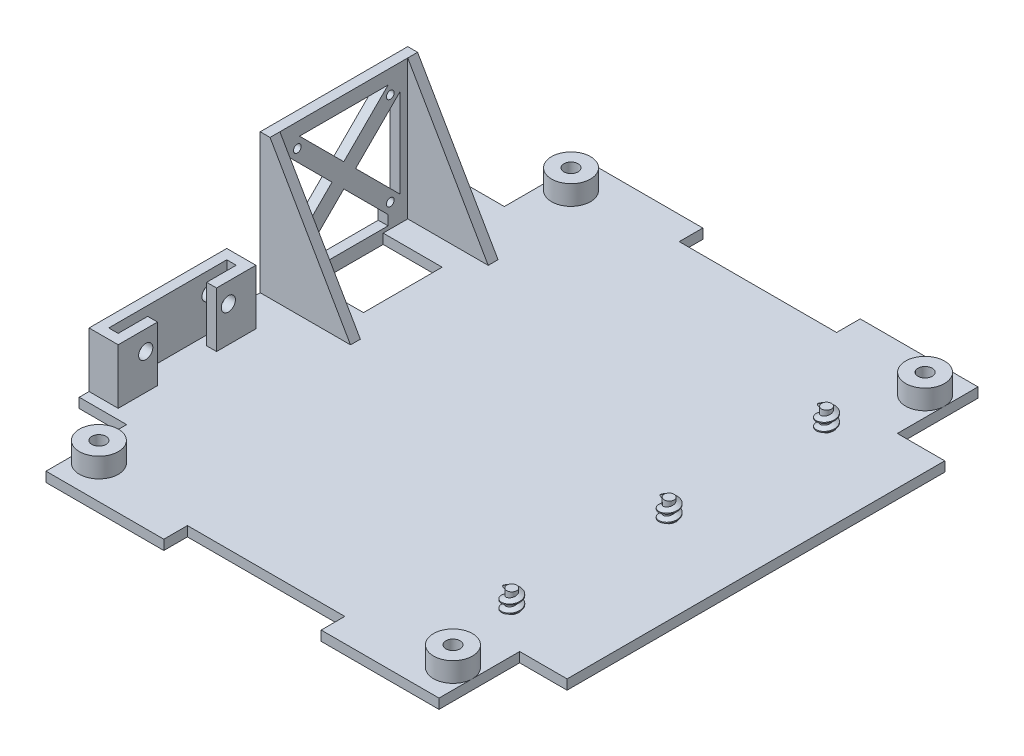
from build123d import *

# Parameters (mm, degrees)
SKETCH1_R           = 2.286
MAIN_BODY_DEPTH     = 3.175
SKETCH34_W          = 7.62
SKETCH34_H          = 50.8
BOSS_EXTRUDE3_DEPTH = 3.175
SKETCH3_R           = 1.5875
BOSS_EXTRUDE2_DEPTH = 6.35
THREAD1_PITCH       = 2.54
THREAD2_PITCH       = 2.54
THREAD3_PITCH       = 2.54
SKETCH35_R          = 6.28142
SKETCH35_R_2        = 2.286
BOSS_EXTRUDE4_DEPTH = 6.35
SKETCH37_W          = 3.175
SKETCH37_H          = 47.625
BOSS_EXTRUDE5_DEPTH = 45
BOSS_EXTRUDE6_DEPTH = 3.175
BOSS_EXTRUDE7_DEPTH = 3.175
SKETCH40_R          = 1.25
CUT_EXTRUDE3_DEPTH  = 3.175
CUT_EXTRUDE4_REACH  = 127.671
SKETCH41_W          = 19.05
SKETCH41_H          = 25.4
BOSS_EXTRUDE8_DEPTH = 17.78
CUT_EXTRUDE5_REACH  = 188.25
SKETCH47_R          = 2.286
CUT_EXTRUDE6_REACH  = 188.25
SKETCH48_W          = 28.575
SKETCH48_H          = 3.175


with BuildPart() as part:
    # Sketch1 → Main Body (new body)
    with BuildSketch(Plane(origin=(0, 0, 0), x_dir=(1, 0, 0), z_dir=(0, 1, 0))):
        Polygon((-25.4, 86.995), (-63.43142, 86.995), (-63.43142, 60.96), (-78.74, 60.96), (-78.74, 25.4), (-71.12, 25.4), (-71.12, -25.4), (-78.74, -25.4), (-78.74, -60.96), (-63.43142, -60.96), (-63.43142, -86.995), (-25.4, -86.995), (-25.4, -79.375), (25.4, -79.375), (25.4, -86.995), (63.43142, -86.995), (63.43142, -60.96), (78.74, -60.96), (78.74, -25.4), (71.12, -25.4), (71.12, 25.4), (78.74, 25.4), (78.74, 60.96), (63.43142, 60.96), (63.43142, 86.995), (25.4, 86.995), (25.4, 79.375), (-25.4, 79.375), align=None)
        with Locations(Location((-57.15, 76.2, 0), (0, 0, 270))):
            Circle(SKETCH1_R, mode=Mode.SUBTRACT)
        with Locations(Location((57.15, 76.2, 0), (0, 0, 270))):
            Circle(SKETCH1_R, mode=Mode.SUBTRACT)
        with Locations(Location((57.15, -76.2, 0), (0, 0, 270))):
            Circle(SKETCH1_R, mode=Mode.SUBTRACT)
        with Locations(Location((-57.15, -76.2, 0), (0, 0, 270))):
            Circle(SKETCH1_R, mode=Mode.SUBTRACT)
    extrude(amount=MAIN_BODY_DEPTH)

    # Sketch34 → Boss-Extrude3 (add)
    with BuildSketch(Plane(origin=(0, 3.175, 0), x_dir=(1, 0, 0), z_dir=(0, 1, 0))):
        with Locations((-74.93, 0)):
            Rectangle(SKETCH34_W, SKETCH34_H)
        with Locations((74.93, 0)):
            Rectangle(SKETCH34_W, SKETCH34_H)
    extrude(amount=-BOSS_EXTRUDE3_DEPTH)

    # Sketch3 → Boss-Extrude2 (add)
    with BuildSketch(Plane(origin=(0, 3.175, 0), x_dir=(1, 0, 0), z_dir=(0, 1, 0))):
        with Locations(Location((50.73142, 50.8, 0), (0, 0, 270))):
            Circle(SKETCH3_R)
        with Locations(Location((50.73142, 0, 0), (0, 0, 270))):
            Circle(SKETCH3_R)
        with Locations(Location((50.73142, -50.8, 0), (0, 0, 270))):
            Circle(SKETCH3_R)
    extrude(amount=BOSS_EXTRUDE2_DEPTH)

    # Thread1: the profile of Thread Profile1 profile screwed along a right-hand helix of 2.5 turns, 10 arcs to a turn; built about Z, then put on its axis
    thread1_z = Axis((0, 0, 0), (0, 0, 1))
    thread1_corners = [(1.5872, 0, -0.000173205), (2.962315322, 0, 0.793749997), (2.962315322, 0, 1.111249997), (1.5872, 0, 1.905173198)]
    with BuildLine(mode=Mode.PRIVATE) as thread1_profile:
        Line(thread1_corners[0], thread1_corners[1])
        Line(thread1_corners[1], thread1_corners[2])
        Line(thread1_corners[2], thread1_corners[3])
        Line(thread1_corners[3], thread1_corners[0])
    thread1_cap = Face(thread1_profile.wire())
    thread1_turn_angles = [0, 18, 36, 54, 72, 90, 108, 126, 144, 162, 180, 198, 216, 234, 252, 270, 288, 306, 324, 342, 360]
    thread1_turn_weights = [1, 0.9510565162951535, 1, 0.9510565162951535, 1, 0.9510565162951535, 1, 0.9510565162951535, 1, 0.9510565162951535, 1, 0.9510565162951535, 1, 0.9510565162951535, 1, 0.9510565162951535, 1, 0.9510565162951535, 1, 0.9510565162951535, 1]
    thread1_turn_rails = [Edge.make_bspline([Vector(p[0], p[1], 0).rotate(thread1_z, thread1_turn_angles[k]) / thread1_turn_weights[k] + Vector(0, 0, p[2] + THREAD1_PITCH * thread1_turn_angles[k] / 360) for k in range(21)], [0, 0, 0, 1, 1, 2, 2, 3, 3, 4, 4, 5, 5, 6, 6, 7, 7, 8, 8, 9, 9, 10, 10, 10], 2, thread1_turn_weights) for p in thread1_corners]
    thread1_turn_sides = [Face.make_surface_from_curves(thread1_turn_rails[p[0]], thread1_turn_rails[p[1]]) for p in [(0, 1), (1, 2), (2, 3), (3, 0)]]
    thread1_last_angles = [720, 738, 756, 774, 792, 810, 828, 846, 864, 882, 900]
    thread1_last_weights = [1, 0.9510565162951535, 1, 0.9510565162951535, 1, 0.9510565162951535, 1, 0.9510565162951535, 1, 0.9510565162951542, 1]
    thread1_last_rails = [Edge.make_bspline([Vector(p[0], p[1], 0).rotate(thread1_z, thread1_last_angles[k]) / thread1_last_weights[k] + Vector(0, 0, p[2] + THREAD1_PITCH * thread1_last_angles[k] / 360) for k in range(11)], [0, 0, 0, 1, 1, 2, 2, 3, 3, 4, 4, 5, 5, 5], 2, thread1_last_weights) for p in thread1_corners]
    thread1_last_sides = [Face.make_surface_from_curves(thread1_last_rails[p[0]], thread1_last_rails[p[1]]) for p in [(0, 1), (1, 2), (2, 3), (3, 0)]]
    thread1 = Plane(origin=(50.73142, 9.525, -50.8), x_dir=(-1, 0, 0), z_dir=(0, -1, 0)) * Solid(Shell([*[p.moved(Location((0, 0, THREAD1_PITCH * i))) for i in range(2) for p in thread1_turn_sides], *thread1_last_sides, thread1_cap, thread1_cap.rotate(thread1_z, 900).moved(Location((0, 0, THREAD1_PITCH * 900 / 360)))]))
    add(thread1)

    # Thread2: the profile of Thread Profile3 profile screwed along a right-hand helix of 2.5 turns, 10 arcs to a turn; built about Z, then put on its axis
    thread2_z = Axis((0, 0, 0), (0, 0, 1))
    thread2_corners = [(1.5872, 0, -0.000173205), (2.962315322, 0, 0.793749997), (2.962315322, 0, 1.111249997), (1.5872, 0, 1.905173198)]
    with BuildLine(mode=Mode.PRIVATE) as thread2_profile:
        Line(thread2_corners[0], thread2_corners[1])
        Line(thread2_corners[1], thread2_corners[2])
        Line(thread2_corners[2], thread2_corners[3])
        Line(thread2_corners[3], thread2_corners[0])
    thread2_cap = Face(thread2_profile.wire())
    thread2_turn_angles = [0, 18, 36, 54, 72, 90, 108, 126, 144, 162, 180, 198, 216, 234, 252, 270, 288, 306, 324, 342, 360]
    thread2_turn_weights = [1, 0.9510565162951535, 1, 0.9510565162951535, 1, 0.9510565162951535, 1, 0.9510565162951535, 1, 0.9510565162951535, 1, 0.9510565162951535, 1, 0.9510565162951535, 1, 0.9510565162951535, 1, 0.9510565162951535, 1, 0.9510565162951535, 1]
    thread2_turn_rails = [Edge.make_bspline([Vector(p[0], p[1], 0).rotate(thread2_z, thread2_turn_angles[k]) / thread2_turn_weights[k] + Vector(0, 0, p[2] + THREAD2_PITCH * thread2_turn_angles[k] / 360) for k in range(21)], [0, 0, 0, 1, 1, 2, 2, 3, 3, 4, 4, 5, 5, 6, 6, 7, 7, 8, 8, 9, 9, 10, 10, 10], 2, thread2_turn_weights) for p in thread2_corners]
    thread2_turn_sides = [Face.make_surface_from_curves(thread2_turn_rails[p[0]], thread2_turn_rails[p[1]]) for p in [(0, 1), (1, 2), (2, 3), (3, 0)]]
    thread2_last_angles = [720, 738, 756, 774, 792, 810, 828, 846, 864, 882, 900]
    thread2_last_weights = [1, 0.9510565162951535, 1, 0.9510565162951535, 1, 0.9510565162951535, 1, 0.9510565162951535, 1, 0.9510565162951542, 1]
    thread2_last_rails = [Edge.make_bspline([Vector(p[0], p[1], 0).rotate(thread2_z, thread2_last_angles[k]) / thread2_last_weights[k] + Vector(0, 0, p[2] + THREAD2_PITCH * thread2_last_angles[k] / 360) for k in range(11)], [0, 0, 0, 1, 1, 2, 2, 3, 3, 4, 4, 5, 5, 5], 2, thread2_last_weights) for p in thread2_corners]
    thread2_last_sides = [Face.make_surface_from_curves(thread2_last_rails[p[0]], thread2_last_rails[p[1]]) for p in [(0, 1), (1, 2), (2, 3), (3, 0)]]
    thread2 = Plane(origin=(50.73142, 9.525, 0), x_dir=(-1, 0, 0), z_dir=(0, -1, 0)) * Solid(Shell([*[p.moved(Location((0, 0, THREAD2_PITCH * i))) for i in range(2) for p in thread2_turn_sides], *thread2_last_sides, thread2_cap, thread2_cap.rotate(thread2_z, 900).moved(Location((0, 0, THREAD2_PITCH * 900 / 360)))]))
    add(thread2)

    # Thread3: the profile of Thread Profile4 profile screwed along a right-hand helix of 2.5 turns, 10 arcs to a turn; built about Z, then put on its axis
    thread3_z = Axis((0, 0, 0), (0, 0, 1))
    thread3_corners = [(1.5872, 0, -0.000173205), (2.962315322, 0, 0.793749997), (2.962315322, 0, 1.111249997), (1.5872, 0, 1.905173198)]
    with BuildLine(mode=Mode.PRIVATE) as thread3_profile:
        Line(thread3_corners[0], thread3_corners[1])
        Line(thread3_corners[1], thread3_corners[2])
        Line(thread3_corners[2], thread3_corners[3])
        Line(thread3_corners[3], thread3_corners[0])
    thread3_cap = Face(thread3_profile.wire())
    thread3_turn_angles = [0, 18, 36, 54, 72, 90, 108, 126, 144, 162, 180, 198, 216, 234, 252, 270, 288, 306, 324, 342, 360]
    thread3_turn_weights = [1, 0.9510565162951535, 1, 0.9510565162951535, 1, 0.9510565162951535, 1, 0.9510565162951535, 1, 0.9510565162951535, 1, 0.9510565162951535, 1, 0.9510565162951535, 1, 0.9510565162951535, 1, 0.9510565162951535, 1, 0.9510565162951535, 1]
    thread3_turn_rails = [Edge.make_bspline([Vector(p[0], p[1], 0).rotate(thread3_z, thread3_turn_angles[k]) / thread3_turn_weights[k] + Vector(0, 0, p[2] + THREAD3_PITCH * thread3_turn_angles[k] / 360) for k in range(21)], [0, 0, 0, 1, 1, 2, 2, 3, 3, 4, 4, 5, 5, 6, 6, 7, 7, 8, 8, 9, 9, 10, 10, 10], 2, thread3_turn_weights) for p in thread3_corners]
    thread3_turn_sides = [Face.make_surface_from_curves(thread3_turn_rails[p[0]], thread3_turn_rails[p[1]]) for p in [(0, 1), (1, 2), (2, 3), (3, 0)]]
    thread3_last_angles = [720, 738, 756, 774, 792, 810, 828, 846, 864, 882, 900]
    thread3_last_weights = [1, 0.9510565162951535, 1, 0.9510565162951535, 1, 0.9510565162951535, 1, 0.9510565162951535, 1, 0.9510565162951542, 1]
    thread3_last_rails = [Edge.make_bspline([Vector(p[0], p[1], 0).rotate(thread3_z, thread3_last_angles[k]) / thread3_last_weights[k] + Vector(0, 0, p[2] + THREAD3_PITCH * thread3_last_angles[k] / 360) for k in range(11)], [0, 0, 0, 1, 1, 2, 2, 3, 3, 4, 4, 5, 5, 5], 2, thread3_last_weights) for p in thread3_corners]
    thread3_last_sides = [Face.make_surface_from_curves(thread3_last_rails[p[0]], thread3_last_rails[p[1]]) for p in [(0, 1), (1, 2), (2, 3), (3, 0)]]
    thread3 = Plane(origin=(50.73142, 9.525, 50.8), x_dir=(-1, 0, 0), z_dir=(0, -1, 0)) * Solid(Shell([*[p.moved(Location((0, 0, THREAD3_PITCH * i))) for i in range(2) for p in thread3_turn_sides], *thread3_last_sides, thread3_cap, thread3_cap.rotate(thread3_z, 900).moved(Location((0, 0, THREAD3_PITCH * 900 / 360)))]))
    add(thread3)

    # Sketch35 → Boss-Extrude4 (add)
    # profile 1 of 4: a face of its own
    with BuildSketch(Plane(origin=(0, 3.175, 0), x_dir=(1, 0, 0), z_dir=(0, 1, 0))):
        with Locations((57.15, 76.2)):
            Circle(SKETCH35_R)
        with Locations(Location((57.15, 76.2, 0), (0, 0, 270))):
            Circle(SKETCH35_R_2, mode=Mode.SUBTRACT)
    # profile 2 of 4: a face of its own
    with BuildSketch(Plane(origin=(0, 3.175, 0), x_dir=(1, 0, 0), z_dir=(0, 1, 0))):
        with Locations((57.15, -76.2)):
            Circle(SKETCH35_R)
        with Locations(Location((57.15, -76.2, 0), (0, 0, 270))):
            Circle(SKETCH35_R_2, mode=Mode.SUBTRACT)
    # profile 3 of 4: a face of its own
    with BuildSketch(Plane(origin=(0, 3.175, 0), x_dir=(1, 0, 0), z_dir=(0, 1, 0))):
        with Locations(Location((-57.15, -76.2, 0), (0, 0, 180))):
            Circle(SKETCH35_R)
        with Locations(Location((-57.15, -76.2, 0), (0, 0, 270))):
            Circle(SKETCH35_R_2, mode=Mode.SUBTRACT)
    # profile 4 of 4: a face of its own
    with BuildSketch(Plane(origin=(0, 3.175, 0), x_dir=(1, 0, 0), z_dir=(0, 1, 0))):
        with Locations(Location((-57.15, 76.2, 0), (0, 0, 180))):
            Circle(SKETCH35_R)
        with Locations(Location((-57.15, 76.2, 0), (0, 0, 270))):
            Circle(SKETCH35_R_2, mode=Mode.SUBTRACT)
    extrude(amount=BOSS_EXTRUDE4_DEPTH)

    # Sketch37 → Boss-Extrude5 (add)
    with BuildSketch(Plane(origin=(0, 3.175, 0), x_dir=(1, 0, 0), z_dir=(0, 1, 0))):
        with Locations((-77.1525, 21.2725)):
            Rectangle(SKETCH37_W, SKETCH37_H)
    extrude(amount=BOSS_EXTRUDE5_DEPTH)

    # Sketch38 → Boss-Extrude6 (add)
    with BuildSketch(Plane(origin=(0, 0, -45.085), x_dir=(-1, 0, 0), z_dir=(0, 0, -1))):
        Polygon((75.565, 48.175), (49.584237886, 3.175), (75.565, 3.175), align=None)
    extrude(amount=-BOSS_EXTRUDE6_DEPTH)

    # Sketch39 → Boss-Extrude7 (add)
    with BuildSketch(Plane.XY.offset(2.54)):
        Polygon((-49.584237886, 3.175), (-75.565, 3.175), (-75.565, 48.175), align=None)
    extrude(amount=-BOSS_EXTRUDE7_DEPTH)

    # Sketch40 → Cut-Extrude3 (cut)
    with BuildSketch(Plane.ZY.offset(78.74)):
        with Locations((-36.2725, 40.675)):
            Circle(SKETCH40_R)
        with Locations((-6.2725, 40.675)):
            Circle(SKETCH40_R)
        with Locations((-6.2725, 10.675)):
            Circle(SKETCH40_R)
        with Locations((-36.2725, 10.675)):
            Circle(SKETCH40_R)
        Polygon((-35.56, 43.7725), (-6.985, 43.7725), (-21.2725, 29.485), align=None)
        Polygon((-17.4625, 25.675), (-3.175, 39.9625), (-3.175, 11.3875), align=None)
        Polygon((-21.2725, 21.865), (-6.985, 7.5775), (-35.56, 7.5775), align=None)
        Polygon((-25.0825, 25.675), (-39.37, 11.3875), (-39.37, 39.9625), align=None)
    extrude(amount=-CUT_EXTRUDE3_DEPTH, mode=Mode.SUBTRACT)

    # Sketch41 → Cut-Extrude4 (cut, up to next)
    with BuildSketch(Plane(origin=(0, 3.175, 0), x_dir=(1, 0, 0), z_dir=(0, 1, 0)), mode=Mode.PRIVATE) as cut_extrude4_sk1:
        with Locations((-66.04, 21.2725)):
            Rectangle(SKETCH41_W, SKETCH41_H)
    cut_extrude4_tool1 = extrude(cut_extrude4_sk1.sketch, amount=-CUT_EXTRUDE4_REACH, mode=Mode.PRIVATE) & part.part
    add(cut_extrude4_tool1.solids().sort_by_distance((-66.04, 3.175, -21.2725))[0], mode=Mode.SUBTRACT)

    # Sketch46 → Boss-Extrude8 (add)
    with BuildSketch(Plane(origin=(0, 3.175, 0), x_dir=(1, 0, 0), z_dir=(0, 1, 0))):
        Polygon((-69.342, -26.035), (-69.342, -13.335), (-78.74, -13.335), (-78.74, -57.785), (-69.342, -57.785), (-69.342, -45.085), (-72.517, -45.085), (-72.517, -54.61), (-75.565, -54.61), (-75.565, -16.51), (-72.517, -16.51), (-72.517, -26.035), align=None)
    extrude(amount=BOSS_EXTRUDE8_DEPTH)

    # Cut-Extrude5: up to this face of the body (flat: up to its plane)
    cut_extrude5_end = Plane(part.part.faces().sort_by_distance((-69.342, 12.065, 19.685))[0])
    # Sketch47 → Cut-Extrude5 (cut, up to the picked face)
    with BuildSketch(Plane.ZY.offset(78.74), mode=Mode.PRIVATE) as cut_extrude5_sk1:
        with Locations((48.895, 14.605)):
            Circle(SKETCH47_R)
    cut_extrude5_tool1 = split(extrude(cut_extrude5_sk1.sketch, amount=-CUT_EXTRUDE5_REACH, mode=Mode.PRIVATE), bisect_by=cut_extrude5_end, keep=Keep.BOTH, mode=Mode.PRIVATE)
    # Sketch47 → Cut-Extrude5 (cut, up to the picked face)
    with BuildSketch(Plane.ZY.offset(78.74), mode=Mode.PRIVATE) as cut_extrude5_sk2:
        with Locations((22.225, 14.605)):
            Circle(SKETCH47_R)
    cut_extrude5_tool2 = split(extrude(cut_extrude5_sk2.sketch, amount=-CUT_EXTRUDE5_REACH, mode=Mode.PRIVATE), bisect_by=cut_extrude5_end, keep=Keep.BOTH, mode=Mode.PRIVATE)
    add(cut_extrude5_tool1.solids().sort_by(Axis((-78.74, 14.605, 48.895), (1, 0, 0)))[0], mode=Mode.SUBTRACT)
    add(cut_extrude5_tool2.solids().sort_by(Axis((-78.74, 14.605, 22.225), (1, 0, 0)))[0], mode=Mode.SUBTRACT)

    # Sketch48 → Cut-Extrude6 (cut, up to next)
    with BuildSketch(Plane.ZY.offset(78.74), mode=Mode.PRIVATE) as cut_extrude6_sk1:
        with Locations((-21.2725, 5.99)):
            Rectangle(SKETCH48_W, SKETCH48_H)
    cut_extrude6_tool1 = extrude(cut_extrude6_sk1.sketch, amount=-CUT_EXTRUDE6_REACH, mode=Mode.PRIVATE) & part.part
    add(cut_extrude6_tool1.solids().sort_by_distance((-78.74, 5.99, -21.2725))[0], mode=Mode.SUBTRACT)


solid = part.part
